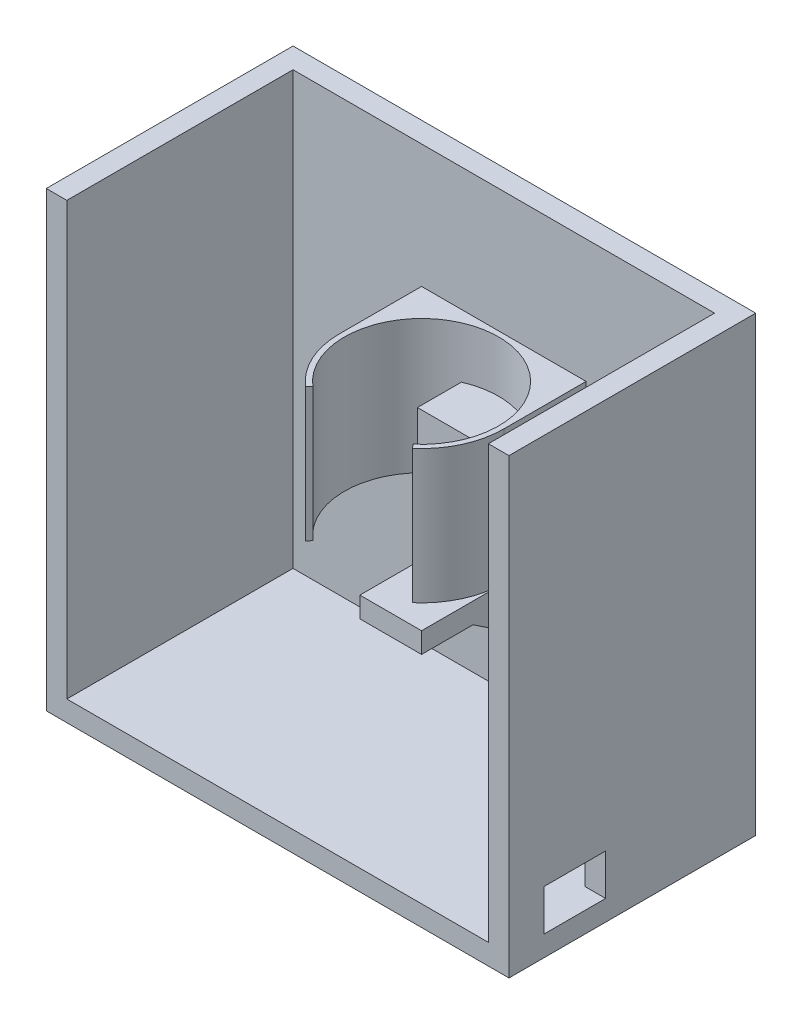
from build123d import *

# Parameters (mm, degrees)
CROQUIS1_W                  = 225
CROQUIS1_H                  = 220
SALIENTE_EXTRUIR1_DEPTH     = 120
CROQUIS2_W                  = 205
CROQUIS2_H                  = 210
CORTAR_EXTRUIR1_DEPTH       = 110
CROQUIS3_W                  = 30
CROQUIS3_H                  = 10
SALIENTE_EXTRUIR2_DEPTH     = 55
NERVIO4_REACH               = 276.693
CROQUIS6_WALL_W             = 587.44153369
CROQUIS6_WALL_H             = 30
SALIENTE_EXTRUIR3_DEPTH     = 65
SALIENTE_EXTRUIR4_START     = -15
SALIENTE_EXTRUIR4_OUTLINE_W = 40
SALIENTE_EXTRUIR4_OUTLINE_H = 27
SALIENTE_EXTRUIR4_DEPTH     = 52.5
CORTAR_EXTRUIR2_REACH       = 332.189
CROQUIS10_W                 = 30
CROQUIS10_H                 = 20
CORTAR_EXTRUIR3_REACH       = 276.693
CROQUIS11_W                 = 22
CROQUIS11_H                 = 17


with BuildPart() as part:
    # Croquis1 → Saliente-Extruir1 (new body)
    with BuildSketch(Plane.XY):
        with Locations((0, 110)):
            Rectangle(CROQUIS1_W, CROQUIS1_H)
    extrude(amount=SALIENTE_EXTRUIR1_DEPTH)

    # Croquis2 → Cortar-Extruir1 (cut)
    with BuildSketch(Plane.XY.offset(120)):
        with Locations((0, 115)):
            Rectangle(CROQUIS2_W, CROQUIS2_H)
    extrude(amount=-CORTAR_EXTRUIR1_DEPTH, mode=Mode.SUBTRACT)

    # Croquis3 → Saliente-Extruir2 (add)
    with BuildSketch(Plane.XY.offset(10)):
        with Locations((0, 65)):
            Rectangle(CROQUIS3_W, CROQUIS3_H)
    extrude(amount=SALIENTE_EXTRUIR2_DEPTH)

    # Croquis6 wall → Nervio4 (add, up to next)
    with BuildSketch(Plane(origin=(0, 50, 25), x_dir=(0, -0.554700196225, -0.832050294338), z_dir=(0, 0.832050294338, -0.554700196225)), mode=Mode.PRIVATE) as nervio4_sk1:
        Rectangle(CROQUIS6_WALL_W, CROQUIS6_WALL_H)
    nervio4_tool1 = extrude(nervio4_sk1.sketch, amount=NERVIO4_REACH, mode=Mode.PRIVATE) - part.part
    add(nervio4_tool1.solids().sort_by_distance((0, 50, 25))[0])



with BuildPart() as body_2:
    # Croquis7 → Saliente-Extruir3 (new body)
    with BuildSketch(Plane(origin=(0, 160, 0), x_dir=(1, 0, 0), z_dir=(0, 1, 0))):
        with BuildLine():
            Line((-40, -50), (-40, -10))
            Line((-40, -10), (0, -10))
            Line((0, -10), (40, -10))
            Line((40, -10), (40, -50))
            ThreePointArc((40, -50), (36.331804249, -66.733200531), (26, -80.397368307))
            Line((26, -80.397368307), (24.375, -78.497532788))
            ThreePointArc((24.375, -78.497532788), (0, -12.5), (-24.375, -78.497532788))
            Line((-24.375, -78.497532788), (-26, -80.397368307))
            ThreePointArc((-26, -80.397368307), (-36.331804249, -66.733200531), (-40, -50))
        make_face()
    extrude(amount=-SALIENTE_EXTRUIR3_DEPTH)


with BuildPart() as part_1:
    add(part.part)

    add(body_2.part)  # Saliente-Extruir4 merges body 2
    # Saliente-Extruir4: read off the stored shape, not the designer's step
    # Saliente-Extruir4 outline → Saliente-Extruir4 (add)
    with BuildSketch(Plane.YZ.offset(SALIENTE_EXTRUIR4_START)):
        with Locations((115, 23.5)):
            Rectangle(SALIENTE_EXTRUIR4_OUTLINE_W, SALIENTE_EXTRUIR4_OUTLINE_H)
    extrude(amount=SALIENTE_EXTRUIR4_DEPTH)

    # Croquis10 → Cortar-Extruir2 (cut, up to next)
    with BuildSketch(Plane.ZY.offset(-102.5), mode=Mode.PRIVATE) as cortar_extruir2_sk1:
        with Locations((88, 20)):
            Rectangle(CROQUIS10_W, CROQUIS10_H)
    cortar_extruir2_tool1 = extrude(cortar_extruir2_sk1.sketch, amount=-CORTAR_EXTRUIR2_REACH, mode=Mode.PRIVATE) & part_1.part
    add(cortar_extruir2_tool1.solids().sort_by_distance((102.5, 20, 88))[0], mode=Mode.SUBTRACT)

    # Croquis11 → Cortar-Extruir3 (cut, up to next)
    with BuildSketch(Plane(origin=(0, 0, 0), x_dir=(-1, 0, 0), z_dir=(0, 0, -1)), mode=Mode.PRIVATE) as cortar_extruir3_sk1:
        with Locations((-72.5, 30)):
            Rectangle(CROQUIS11_W, CROQUIS11_H)
    cortar_extruir3_tool1 = extrude(cortar_extruir3_sk1.sketch, amount=-CORTAR_EXTRUIR3_REACH, mode=Mode.PRIVATE) & part_1.part
    add(cortar_extruir3_tool1.solids().sort_by_distance((72.5, 30, 0))[0], mode=Mode.SUBTRACT)


solid = part_1.part
